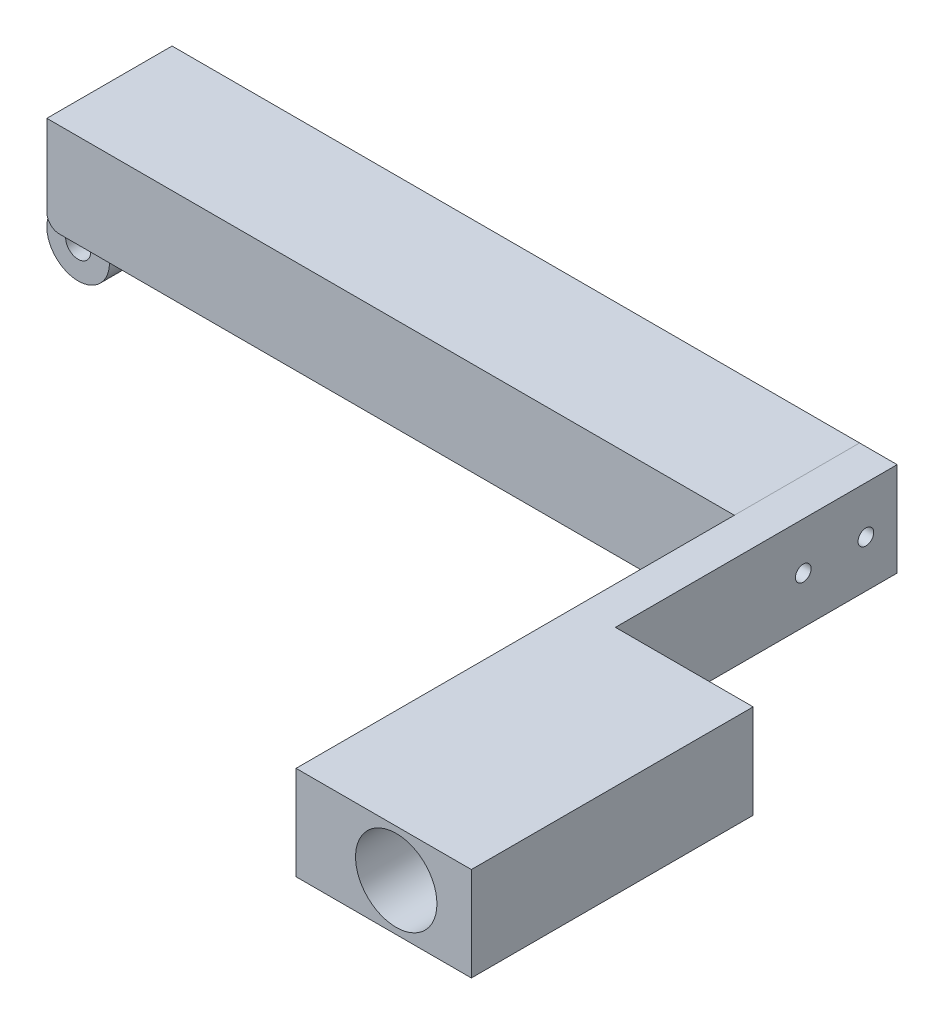
from build123d import *

# Parameters (mm, degrees)
SKETCH4_W                 = 20
SKETCH4_H                 = 15
BOSS_EXTRUDE1_DEPTH       = 115.8
SKETCH5_W                 = 6
SKETCH5_H                 = 15
BOSS_EXTRUDE2_DEPTH       = 35
BOSS_EXTRUDE3_DEPTH       = 35
BOSS_EXTRUDE3_DEPTH_BACK  = 10
SKETCH6_W                 = 28
SKETCH6_H                 = 15
SKETCH6_R                 = 6.5
SKETCH7_R                 = 2
BOSS_EXTRUDE4_DEPTH       = 5
FILLET1_R                 = 2
FILLET2_R                 = 5
M3X0_5_TAPPED_HOLE2_D     = 2.5
M3X0_5_TAPPED_HOLE2_DEPTH = 15
M3X0_5_TAPPED_HOLE2_TIP   = 0.751075774
SKETCH19_R                = 1.5
CUT_EXTRUDE3_DEPTH        = 2.5
SPLIT2_SURFACE_1_BACK     = 171.637
SPLIT2_SURFACE_1_DEPTH    = 343.274
SPLIT2_SURFACE_2_BACK     = 171.637
SPLIT2_SURFACE_2_DEPTH    = 343.274


with BuildPart() as part:
    # Sketch4 → Boss-Extrude1 (new body)
    with BuildSketch(Plane(origin=(0, 0, 0), x_dir=(0, 0, -1), z_dir=(1, 0, 0))):
        Rectangle(SKETCH4_W, SKETCH4_H)
    extrude(amount=BOSS_EXTRUDE1_DEPTH)

    # Sketch5 → Boss-Extrude2 (add)
    with BuildSketch(Plane.XY.offset(10)):
        with Locations((112.8, 0)):
            Rectangle(SKETCH5_W, SKETCH5_H)
    extrude(amount=BOSS_EXTRUDE2_DEPTH)

    # Sketch6 → Boss-Extrude3 (add, two sides: drawn at the far end of the back side and taken through both)
    with BuildSketch(Plane.XY.offset(45).offset(-BOSS_EXTRUDE3_DEPTH_BACK)):
        with Locations((123.8, 0)):
            Rectangle(SKETCH6_W, SKETCH6_H)
        with Locations((125.8, 0)):
            Circle(SKETCH6_R, mode=Mode.SUBTRACT)
    extrude(amount=BOSS_EXTRUDE3_DEPTH + BOSS_EXTRUDE3_DEPTH_BACK)

    # Sketch7 → Boss-Extrude4 (add, symmetric)
    with BuildSketch(Plane.XY):
        with BuildLine():
            Line((5, -12.5), (5, -7.5))
            Line((5, -7.5), (0, -7.5))
            ThreePointArc((0, -7.5), (-3.535533906, -16.035533906), (5, -12.5))
        make_face()
        with Locations((0, -12.5)):
            Circle(SKETCH7_R, mode=Mode.SUBTRACT)
    extrude(amount=BOSS_EXTRUDE4_DEPTH, both=True)

    # Fillet1
    fillet1_edges = [part.edges().sort_by_distance(p)[0] for p in [
        (0, -7.5, 7.5),
        (0, -7.5, -7.5),
    ]]
    fillet(fillet1_edges, radius=FILLET1_R)

    # Fillet2
    fillet2_edges = [part.edges().sort_by_distance(p)[0] for p in [
        (5, -7.5, 0),
    ]]
    fillet(fillet2_edges, radius=FILLET2_R - 0.0001)  # a hair under: the kernel refuses the full size

    # M3x0.5 Tapped Hole2
    with Locations(Plane(origin=(115.8, 0, 0), x_dir=(0, 0, -1), z_dir=(1, 0, 0))):
        with Locations((5, 0), (-5, 0)):
            Hole(M3X0_5_TAPPED_HOLE2_D / 2, depth=M3X0_5_TAPPED_HOLE2_DEPTH)
            with Locations((0, 0, -(M3X0_5_TAPPED_HOLE2_DEPTH + M3X0_5_TAPPED_HOLE2_TIP / 2))):  # 118° drill point
                Cone(0, M3X0_5_TAPPED_HOLE2_D / 2, M3X0_5_TAPPED_HOLE2_TIP, mode=Mode.SUBTRACT)

    # Sketch19 → Cut-Extrude3 (cut)
    with BuildSketch(Plane.ZY):
        with Locations((-7.5, 5)):
            Circle(SKETCH19_R)
        with Locations((-2.5, 5)):
            Circle(SKETCH19_R)
        with Locations((2.5, 5)):
            Circle(SKETCH19_R)
        with Locations((7.5, 5)):
            Circle(SKETCH19_R)
        with Locations((-2.5, 1)):
            Circle(SKETCH19_R)
        with Locations((2.5, 1)):
            Circle(SKETCH19_R)
        with Locations((7.5, 1)):
            Circle(SKETCH19_R)
        with Locations((-2.5, -3)):
            Circle(SKETCH19_R)
        with Locations((2.5, -3)):
            Circle(SKETCH19_R)
        with Locations((7.5, -3)):
            Circle(SKETCH19_R)
        with Locations((-7.5, 1)):
            Circle(SKETCH19_R)
        with Locations((-7.5, -3)):
            Circle(SKETCH19_R)
    extrude(amount=-CUT_EXTRUDE3_DEPTH, mode=Mode.SUBTRACT)


with BuildPart() as body_2:
    # Split2: the piece behind the surface
    add(part.part)
    # Split2 surface: a surface, the sketch's curves swept straight by 343.274 mm
    with BuildLine(Plane(origin=(0, 7.5, 0), x_dir=(1, 0, 0), z_dir=(0, 1, 0)).offset(-SPLIT2_SURFACE_1_BACK), mode=Mode.PRIVATE) as split2_surface_1_path:
        Line((109.8, -10), (109.8, 10))
    split2_surface_1 = Shell.extrude(split2_surface_1_path.wire(), (0 * SPLIT2_SURFACE_1_DEPTH, 1 * SPLIT2_SURFACE_1_DEPTH, 0 * SPLIT2_SURFACE_1_DEPTH))
    split(bisect_by=split2_surface_1, keep=Keep.BOTTOM)


with BuildPart() as part_1:
    add(part.part)

    # Split2: split by a surface, the side it looks to stays
    # Split2 surface: a surface, the sketch's curves swept straight by 343.274 mm
    with BuildLine(Plane(origin=(0, 7.5, 0), x_dir=(1, 0, 0), z_dir=(0, 1, 0)).offset(-SPLIT2_SURFACE_2_BACK), mode=Mode.PRIVATE) as split2_surface_2_path:
        Line((109.8, -10), (109.8, 10))
    split2_surface_2 = Shell.extrude(split2_surface_2_path.wire(), (0 * SPLIT2_SURFACE_2_DEPTH, 1 * SPLIT2_SURFACE_2_DEPTH, 0 * SPLIT2_SURFACE_2_DEPTH))
    split(bisect_by=split2_surface_2, keep=Keep.TOP)


solid = Compound([body_2.part, part_1.part])
